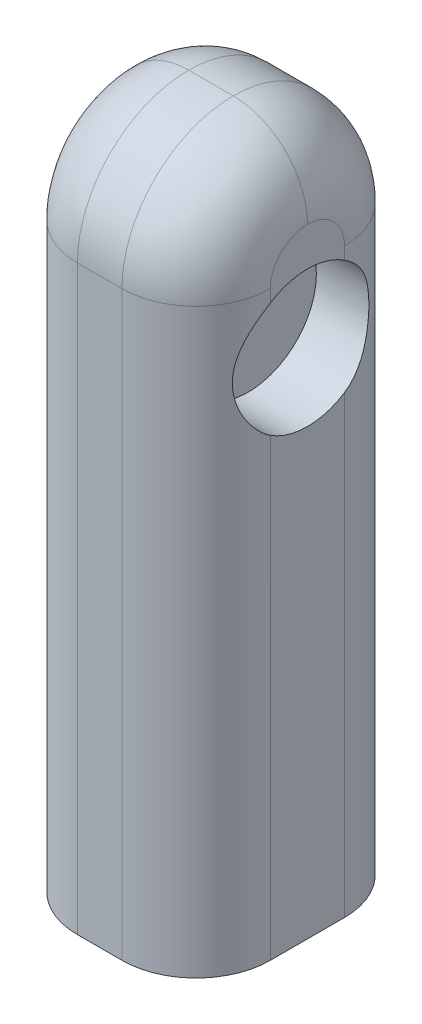
from build123d import *

# Parameters (mm, degrees)
SKETCH2_W           = 26
SKETCH2_H           = 30
BOSS_EXTRUDE1_DEPTH = 93.4
SKETCH3_R           = 9.2
CUT_EXTRUDE1_DEPTH  = 8
CUT_EXTRUDE2_START  = -8
SKETCH4_R           = 9.2
CUT_EXTRUDE2_DEPTH  = 8
FILLET1_R           = 15
FILLET4_R           = 10
FILLET5_R           = 10


# Some blends are built 0.0001 mm under size
with BuildPart() as part:
    # Sketch2 → Boss-Extrude1 (new body)
    with BuildSketch(Plane(origin=(0, 0, 0), x_dir=(1, 0, 0), z_dir=(0, 1, 0))):
        Rectangle(SKETCH2_W, SKETCH2_H)
    extrude(amount=BOSS_EXTRUDE1_DEPTH)

    # Sketch3 → Cut-Extrude1 (cut)
    with BuildSketch(Plane(origin=(13, 0, 0), x_dir=(0, 0, -1), z_dir=(1, 0, 0))):
        with Locations((0, 69)):
            Circle(SKETCH3_R)
    extrude(amount=-CUT_EXTRUDE1_DEPTH, mode=Mode.SUBTRACT)

    # Sketch4 → Cut-Extrude2 (cut)
    with BuildSketch(Plane.ZY.offset(13).offset(CUT_EXTRUDE2_START)):
        with Locations(Location((0, 69, 0), (0, 0, 180))):
            Circle(SKETCH4_R)
    extrude(amount=CUT_EXTRUDE2_DEPTH, mode=Mode.SUBTRACT)

    # Fillet1
    fillet1_edges = [part.edges().sort_by_distance(p)[0] for p in [
        (0, 93.4, 15),
        (0, 93.4, -15),
    ]]
    fillet(fillet1_edges, radius=FILLET1_R - 0.0001)  # a hair under: the kernel refuses the full size

    # Fillet4
    # the kernel refuses this fillet: 10 mm, written as the material it takes off along each edge
    with BuildSketch(Plane(origin=(-13, -25, 15), x_dir=(0, 0, -1), z_dir=(0, 1, 0)), Plane(origin=(-13, -25, -15), x_dir=(1, 0, 0), z_dir=(0, 1, 0))) as fillet4_piece_1:
        with BuildLine():
            CenterArc((FILLET4_R, -FILLET4_R), FILLET4_R, 90, 90)
            Line((0, -FILLET4_R), (0, 0))
            Line((0, 0), (FILLET4_R, 0))
        make_face()
    extrude(amount=103.4001, mode=Mode.SUBTRACT)
    with BuildSketch(Plane(origin=(-13, 78.4001, -0.0001), x_dir=(0, 0, -1), z_dir=(0, -1, 0))) as fillet4_piece_2:
        with BuildLine():
            CenterArc((14.9999 - FILLET4_R, FILLET4_R), FILLET4_R, 270, 90)
            Line((14.9999, FILLET4_R), (14.9999, 0))
            Line((14.9999, 0), (14.9999 - FILLET4_R, 0))
        make_face()
    revolve(axis=Axis((-13, 78.4001, -0.0001), (1, 0, 0)), revolution_arc=90, mode=Mode.SUBTRACT)
    with BuildSketch(Plane(origin=(-13, 78.4001, 0.0001), x_dir=(0, 1, 0), z_dir=(0, 0, -1))) as fillet4_piece_3:
        with BuildLine():
            CenterArc((14.9999 - FILLET4_R, FILLET4_R), FILLET4_R, 270, 90)
            Line((14.9999, FILLET4_R), (14.9999, 0))
            Line((14.9999, 0), (14.9999 - FILLET4_R, 0))
        make_face()
    revolve(axis=Axis((-13, 78.4001, 0.0001), (1, 0, 0)), revolution_arc=90, mode=Mode.SUBTRACT)
    with BuildSketch(Plane(origin=(-13, 93.4, 0.0001), x_dir=(0, -1, 0), z_dir=(0, 0, -1))) as fillet4_piece_4:
        with BuildLine():
            CenterArc((FILLET4_R, -FILLET4_R), FILLET4_R, 90, 90)
            Line((0, -FILLET4_R), (0, 0))
            Line((0, 0), (FILLET4_R, 0))
        make_face()
    extrude(amount=0.0002, mode=Mode.SUBTRACT)

    # Fillet5
    # the kernel refuses this fillet: 10 mm, written as the material it takes off along each edge
    with BuildSketch(Plane(origin=(13, -25, -15), x_dir=(-1, 0, 0), z_dir=(0, 1, 0)), Plane(origin=(13, -25, 15), x_dir=(0, 0, -1), z_dir=(0, 1, 0))) as fillet5_piece_1:
        with BuildLine():
            CenterArc((FILLET5_R, FILLET5_R), FILLET5_R, 180, 90)
            Line((0, FILLET5_R), (0, 0))
            Line((0, 0), (FILLET5_R, 0))
        make_face()
    extrude(amount=103.4001, mode=Mode.SUBTRACT)
    with BuildSketch(Plane(origin=(13, 78.4001, -0.0001), x_dir=(0, 0, -1), z_dir=(0, -1, 0))) as fillet5_piece_2:
        with BuildLine():
            CenterArc((14.9999 - FILLET5_R, -FILLET5_R), FILLET5_R, 0, 90)
            Line((14.9999, -FILLET5_R), (14.9999, 0))
            Line((14.9999, 0), (14.9999 - FILLET5_R, 0))
        make_face()
    revolve(axis=Axis((13, 78.4001, -0.0001), (1, 0, 0)), revolution_arc=90, mode=Mode.SUBTRACT)
    with BuildSketch(Plane(origin=(13, 78.4001, 0.0001), x_dir=(0, 1, 0), z_dir=(0, 0, -1))) as fillet5_piece_3:
        with BuildLine():
            CenterArc((14.9999 - FILLET5_R, -FILLET5_R), FILLET5_R, 0, 90)
            Line((14.9999, -FILLET5_R), (14.9999, 0))
            Line((14.9999, 0), (14.9999 - FILLET5_R, 0))
        make_face()
    revolve(axis=Axis((13, 78.4001, 0.0001), (1, 0, 0)), revolution_arc=90, mode=Mode.SUBTRACT)
    with BuildSketch(Plane(origin=(13, 93.4, -0.0001), x_dir=(0, -1, 0), z_dir=(0, 0, 1))) as fillet5_piece_4:
        with BuildLine():
            CenterArc((FILLET5_R, -FILLET5_R), FILLET5_R, 90, 90)
            Line((0, -FILLET5_R), (0, 0))
            Line((0, 0), (FILLET5_R, 0))
        make_face()
    extrude(amount=0.0002, mode=Mode.SUBTRACT)


solid = part.part
